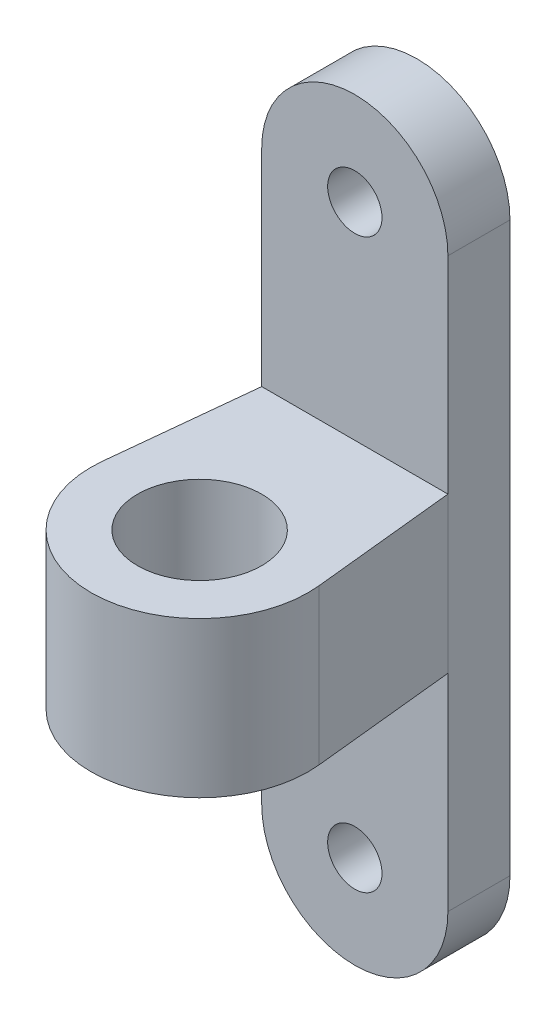
from build123d import *

# Parameters (mm, degrees)
ESBO_O1_R                = 1.75
RESSALTO_EXTRUS_O1_DEPTH = 4
ESBO_O2_W                = 32.967162932
ESBO_O2_H                = 10
RESSALTO_EXTRUS_O2_DEPTH = 25
ESBO_O3_R                = 4
CORTE_EXTRUS_O3_DEPTH    = 42.895088709


with BuildPart() as part:
    # Esboço1 → Ressalto-extrusão1 (new body)
    with BuildSketch(Plane.XY):
        with BuildLine():
            Line((-6, 0), (-6, 36.6))
            ThreePointArc((-6, 36.6), (0, 42.6), (6, 36.6))
            Line((6, 36.6), (6, 0))
            ThreePointArc((6, 0), (0, -6), (-6, 0))
        make_face()
        Circle(ESBO_O1_R, mode=Mode.SUBTRACT)
        with Locations((0, 36.6)):
            Circle(ESBO_O1_R, mode=Mode.SUBTRACT)
    extrude(amount=RESSALTO_EXTRUS_O1_DEPTH)

    # Esboço2 → Ressalto-extrusão2 (add)
    with BuildSketch(Plane(origin=(0, 0, 0), x_dir=(-1, 0, 0), z_dir=(0, 0, -1))):
        with Locations((0, 18.3)):
            Rectangle(ESBO_O2_W, ESBO_O2_H)
    extrude(amount=-RESSALTO_EXTRUS_O2_DEPTH)

    # Esboço3 → Corte-extrusão3 (cut, through all)
    with BuildSketch(Plane(origin=(0, 23.3, 0), x_dir=(1, 0, 0), z_dir=(0, 1, 0))):
        with BuildLine():
            Line((-6.962621571, -13.277572943), (-6, -4))
            Line((-6, -4), (-6, 0))
            Line((-6, 0), (-16.483581466, 0))
            Line((-16.483581466, 0), (-16.483581466, -25))
            Line((-16.483581466, -25), (16.483581466, -25))
            Line((16.483581466, -25), (16.483581466, 0))
            Line((16.483581466, 0), (6, 0))
            Line((6, 0), (6, -4))
            Line((6, -4), (6.962621571, -13.277572943))
            ThreePointArc((6.962621571, -13.277572943), (0, -21), (-6.962621571, -13.277572943))
        make_face()
        with Locations((0, -14)):
            Circle(ESBO_O3_R)
    extrude(amount=-CORTE_EXTRUS_O3_DEPTH, mode=Mode.SUBTRACT)


solid = part.part
